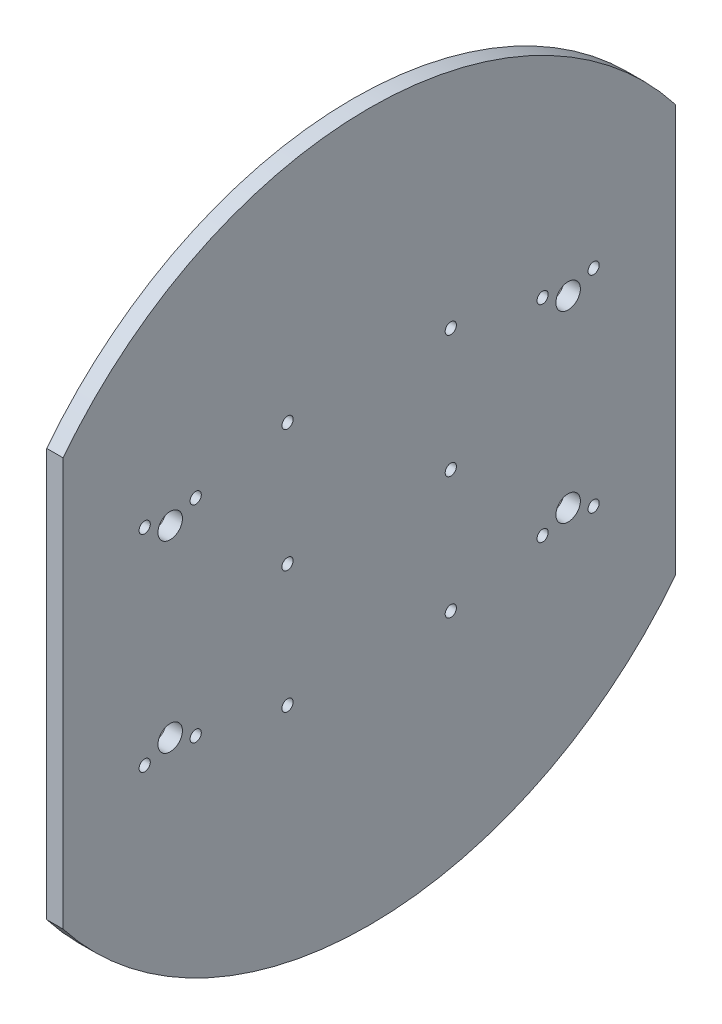
from build123d import *

# Parameters (mm, degrees)
EXTRUDE_1_DEPTH     = 8
SKETCH_2_R          = 6
SKETCH_2_R_2        = 2.75
CUT_EXTRUDE_1_DEPTH = 8
SKETCH_3_R          = 2.75
CUT_EXTRUDE_2_DEPTH = 10


with BuildPart() as part:
    # 草图1 → 凸台-拉伸1 (new body)
    with BuildSketch(Plane(origin=(0, 0, 0), x_dir=(0, 0, -1), z_dir=(1, 0, 0))):
        with BuildLine():
            Line((-150, 100), (-150, -100))
            ThreePointArc((-150, -100), (0, -173.380962103), (150, -100))
            Line((150, -100), (150, 100))
            ThreePointArc((150, 100), (0, 173.380962103), (-150, 100))
        make_face()
    extrude(amount=EXTRUDE_1_DEPTH)

    # 草图2 → 切除-拉伸1 (cut)
    with BuildSketch(Plane(origin=(8, 0, 0), x_dir=(0, 0, -1), z_dir=(1, 0, 0))):
        with Locations((97.5, 45)):
            Circle(SKETCH_2_R)
        with Locations((97.5, -45)):
            Circle(SKETCH_2_R)
        with Locations((85, 50.5)):
            Circle(SKETCH_2_R_2)
        with Locations((110, 50.5)):
            Circle(SKETCH_2_R_2)
        with Locations((85, -50.5)):
            Circle(SKETCH_2_R_2)
        with Locations((110, -50.5)):
            Circle(SKETCH_2_R_2)
        with Locations((-110, -50.5)):
            Circle(SKETCH_2_R_2)
        with Locations((-85, -50.5)):
            Circle(SKETCH_2_R_2)
        with Locations((-110, 50.5)):
            Circle(SKETCH_2_R_2)
        with Locations((-85, 50.5)):
            Circle(SKETCH_2_R_2)
        with Locations((-97.5, -45)):
            Circle(SKETCH_2_R)
        with Locations((-97.5, 45)):
            Circle(SKETCH_2_R)
    extrude(amount=-CUT_EXTRUDE_1_DEPTH, mode=Mode.SUBTRACT)

    # 草图3 → 切除-拉伸2 (cut)
    with BuildSketch(Plane(origin=(8, 0, 0), x_dir=(0, 0, -1), z_dir=(1, 0, 0))):
        with Locations((-40, 60)):
            Circle(SKETCH_3_R)
        with Locations((40, 60)):
            Circle(SKETCH_3_R)
        with Locations((40, -60)):
            Circle(SKETCH_3_R)
        with Locations((-40, -60)):
            Circle(SKETCH_3_R)
        with Locations((40, 0)):
            Circle(SKETCH_3_R)
        with Locations((-40, 0)):
            Circle(SKETCH_3_R)
    extrude(amount=-CUT_EXTRUDE_2_DEPTH, mode=Mode.SUBTRACT)


solid = part.part
